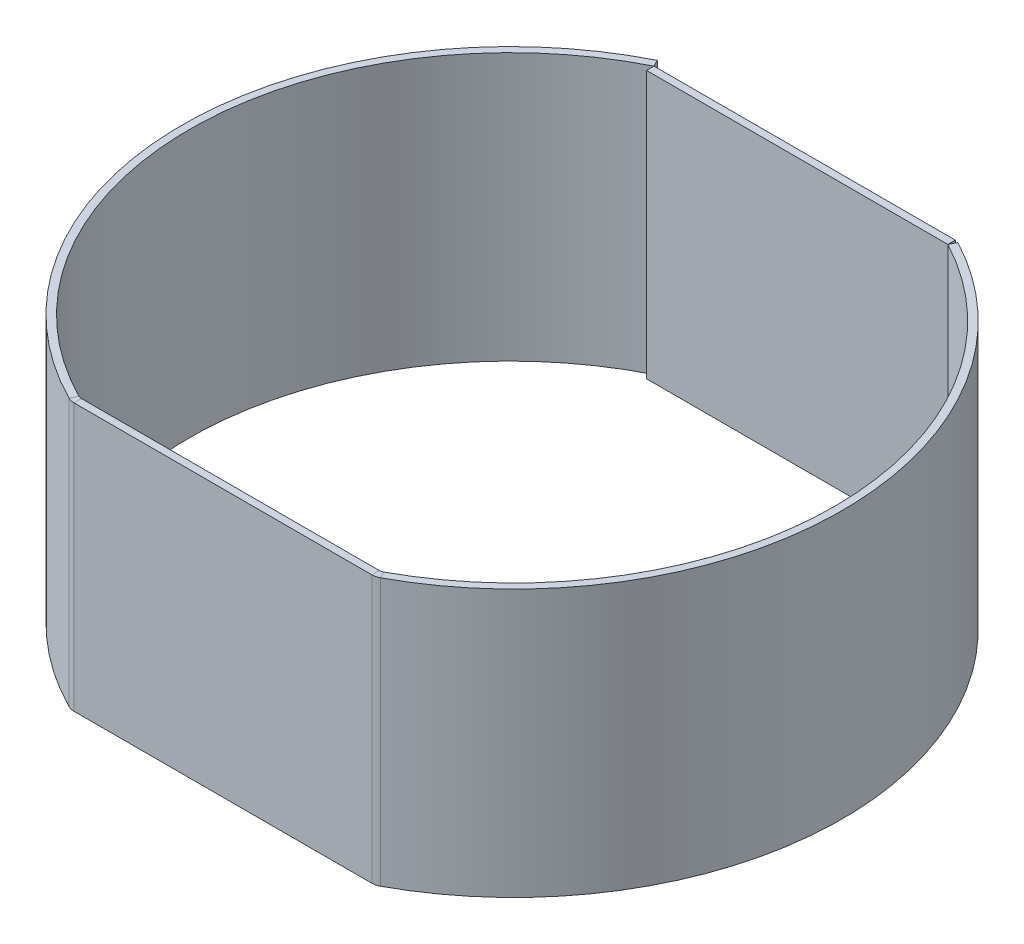
from build123d import *

# Parameters (mm, degrees)
SKETCH1_W          = 29.811444236
SKETCH1_H          = 26.425
BASE_FLANGE1_DEPTH = 0.7366
BASE_FLANGE2_START = -26.425
BASE_FLANGE2_DEPTH = 26.425


# Read off the part's stored shape, not the designer's step: Base-Flange2
# Sheet-metal steps are written as plain solids
with BuildPart() as part:
    # Sketch1 → Base-Flange1 (new body)
    with BuildSketch(Plane.XY):
        with Locations((0, 13.2125)):
            Rectangle(SKETCH1_W, SKETCH1_H)
    extrude(amount=-BASE_FLANGE1_DEPTH)


with BuildPart() as body_2:
    # Base-Flange2 outline → Base-Flange2 (new body)
    with BuildSketch(Plane.XZ.offset(BASE_FLANGE2_START)):
        with BuildLine():
            ThreePointArc((-14.730861876, 56.803772147), (-15.073134478, 56.763460037), (-15.396675433, 56.64472988))
            ThreePointArc((-15.396675433, 56.64472988), (-33.200812457, 27.574771442), (-15.234962217, -1.395523757))
            Line((-15.234962217, -1.395523757), (-14.905722118, -0.7366))
            ThreePointArc((-14.905722118, -0.7366), (-32.464215316, 27.576823767), (-15.063768654, 55.987651013))
            ThreePointArc((-15.063768654, 55.987651013), (-14.901998177, 56.047016092), (-14.730861876, 56.067172147))
            Line((-14.730861876, 56.067172147), (14.720921536, 56.067172147))
            ThreePointArc((14.720921536, 56.067172147), (14.901224998, 56.044764153), (15.070558493, 55.978903511))
            ThreePointArc((15.070558493, 55.978903511), (31.749862353, 27.940094921), (14.905722118, 0))
            Line((14.905722118, 0), (15.251534872, -0.650379197))
            ThreePointArc((15.251534872, -0.650379197), (32.486459159, 27.937925926), (15.42019545, 56.627234876))
            ThreePointArc((15.42019545, 56.627234876), (15.08152846, 56.758956159), (14.720921536, 56.803772147))
            Line((14.720921536, 56.803772147), (-14.730861876, 56.803772147))
        make_face()
    extrude(amount=BASE_FLANGE2_DEPTH)


solid = Compound([part.part, body_2.part])
